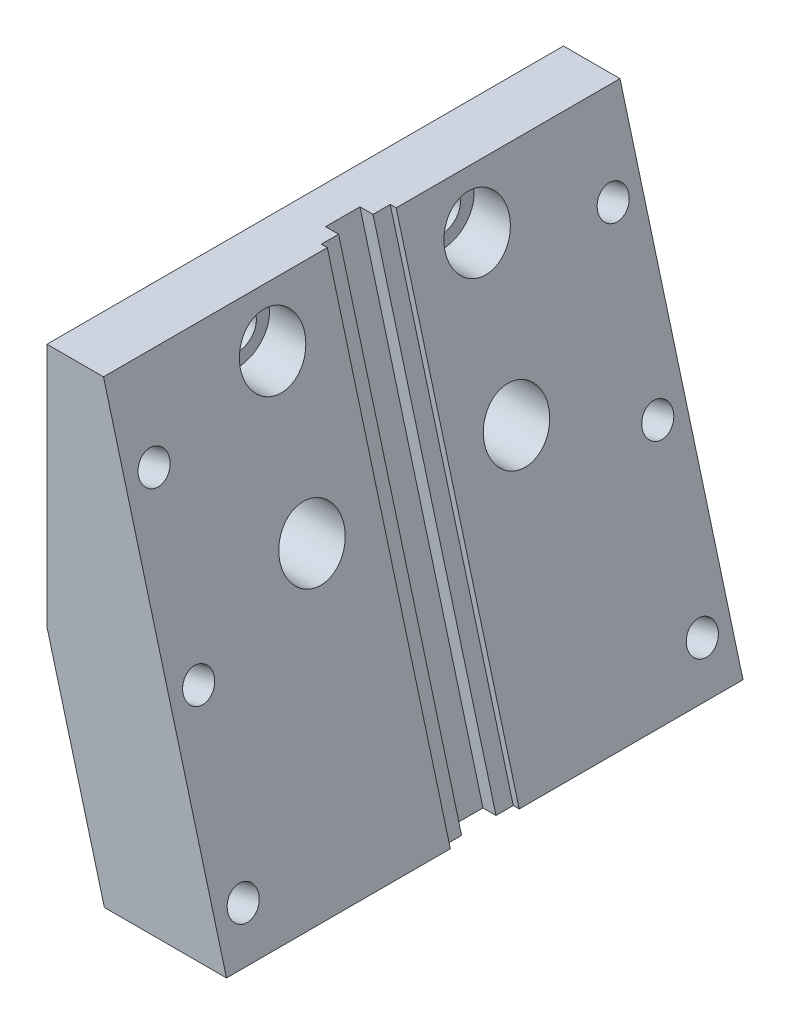
from build123d import *

# Parameters (mm, degrees)
SKETCH1_W                 = 21
SKETCH1_H                 = 45
BOSS_EXTRUDE1_DEPTH       = 40
CHAMFER1_SIZE             = 60
CHAMFER1_SIZE_2           = 16.076951546
SKETCH2_W                 = 3
SKETCH2_H                 = 45
CUT_EXTRUDE1_DEPTH        = 1.6
F_6_32_TAPPED_HOLE1_D     = 2.7051
F_6_32_TAPPED_HOLE1_DEPTH = 9
F_6_32_TAPPED_HOLE1_TIP   = 0.81269403
CHAMFER2_SIZE             = 5
CHAMFER2_SIZE2            = 18.660254038
SKETCH11_R                = 1.63195
CUT_EXTRUDE3_DEPTH        = 10
F_3DSKETCH1_R             = 2.794
CUT_EXTRUDE4_DEPTH        = 8
SKETCH12_W                = 6
SKETCH12_H                = 45
CUT_EXTRUDE5_DEPTH        = 0.5


with BuildPart() as part:
    # Sketch1 → Boss-Extrude1 (new body)
    with BuildSketch(Plane(origin=(0, 0, 0), x_dir=(1, 0, 0), z_dir=(0, 1, 0))):
        Rectangle(SKETCH1_W, SKETCH1_H)
    extrude(amount=-BOSS_EXTRUDE1_DEPTH)

    # Chamfer1
    # the kernel refuses this chamfer: 60, 16.076951546 mm, written as the material it takes off along each edge
    with BuildSketch(Plane(origin=(10.5, 0, 178.303294212), x_dir=(0.009967146577156426, -0.9999503267608394, 0), z_dir=(0, 0, -1))) as chamfer1_piece_1:
        Polygon((CHAMFER1_SIZE * 0.999950326761, CHAMFER1_SIZE * 0.00996714657716), (-CHAMFER1_SIZE_2 * 0.00996714657707, CHAMFER1_SIZE_2 * 0.999950326753), (0, 0), align=None)
    extrude(amount=356.606588424, mode=Mode.SUBTRACT)

    # Sketch2 → Cut-Extrude1 (cut)
    with BuildSketch(Plane(origin=(-5.20336663, -1.394237886, 0), x_dir=(0, 0, -1), z_dir=(0.965925826289069, 0.2588190451025185, 0))):
        with Locations((0, -19.262102335)):
            Rectangle(SKETCH2_W, SKETCH2_H)
    extrude(amount=-CUT_EXTRUDE1_DEPTH, mode=Mode.SUBTRACT)

    # #6-32 Tapped Hole1
    with Locations(Plane(origin=(-5.20336663, -1.394237886, 0), x_dir=(0, 0, -1), z_dir=(0.965925826289069, 0.2588190451025185, 0))):
        with Locations((-20, -20.93024544), (20, -20.93024544), (-20, -5.93024544), (-20, -35.93024544), (20, -35.93024544), (20, -5.93024544)):
            Hole(F_6_32_TAPPED_HOLE1_D / 2, depth=F_6_32_TAPPED_HOLE1_DEPTH)
            with Locations((0, 0, -(F_6_32_TAPPED_HOLE1_DEPTH + F_6_32_TAPPED_HOLE1_TIP / 2))):  # 118° drill point
                Cone(0, F_6_32_TAPPED_HOLE1_D / 2, F_6_32_TAPPED_HOLE1_TIP, mode=Mode.SUBTRACT)

    # Chamfer2
    chamfer2_edges = [part.edges().sort_by_distance(p)[0] for p in [
        (-10.5, -40, 0),
    ]]
    chamfer2_side = [part.faces().sort_by_distance(p)[0] for p in [
        (-2.729210232, -40, 0),
    ]]
    chamfer(chamfer2_edges, length=CHAMFER2_SIZE, length2=CHAMFER2_SIZE2, reference=chamfer2_side[0])

    # Sketch11 → Cut-Extrude3 (cut)
    with BuildSketch(Plane(origin=(-10.5, 29.282032303, 0), x_dir=(0, 0, 1), z_dir=(1, 0, 0))):
        with Locations(Location((8.89, 33.551905284, 0), (0, 0, 270))):
            Circle(SKETCH11_R)
        with Locations((8.89, 46.351905284)):
            Circle(SKETCH11_R)
        with Locations(Location((-8.89, 46.351905284, 0), (0, 0, 270))):
            Circle(SKETCH11_R)
        with Locations((-8.89, 33.551905284)):
            Circle(SKETCH11_R)
    extrude(amount=CUT_EXTRUDE3_DEPTH, mode=Mode.SUBTRACT)

    # 3DSketch1 → Cut-Extrude4 (cut)
    with BuildSketch(Plane(origin=(-7.5, -4.269872981, -8.91), x_dir=(0, -0.5834969796278836, 0.812115308786343), z_dir=(-1, 0, 0))):
        with Locations(Location((0, 0, 0), (0, 0, 305.696879334))):
            Circle(F_3DSKETCH1_R)
        with Locations(Location((14.471894803, 10.397916177, 0), (0, 0, 305.696879334))):
            Circle(F_3DSKETCH1_R)
        with Locations(Location((21.942696816, 0, 0), (0, 0, 305.696879334))):
            Circle(F_3DSKETCH1_R)
        with Locations(Location((7.470802013, -10.397916177, 0), (0, 0, 305.696879334))):
            Circle(F_3DSKETCH1_R)
    extrude(amount=-CUT_EXTRUDE4_DEPTH, mode=Mode.SUBTRACT)

    # Sketch12 → Cut-Extrude5 (cut)
    with BuildSketch(Plane(origin=(-5.20336663, -1.394237886, 0), x_dir=(0, 0, -1), z_dir=(0.9659258262890663, 0.25881904510252807, 0))):
        with Locations((0, -20.203205195)):
            Rectangle(SKETCH12_W, SKETCH12_H)
    extrude(amount=-CUT_EXTRUDE5_DEPTH, mode=Mode.SUBTRACT)


solid = part.part
